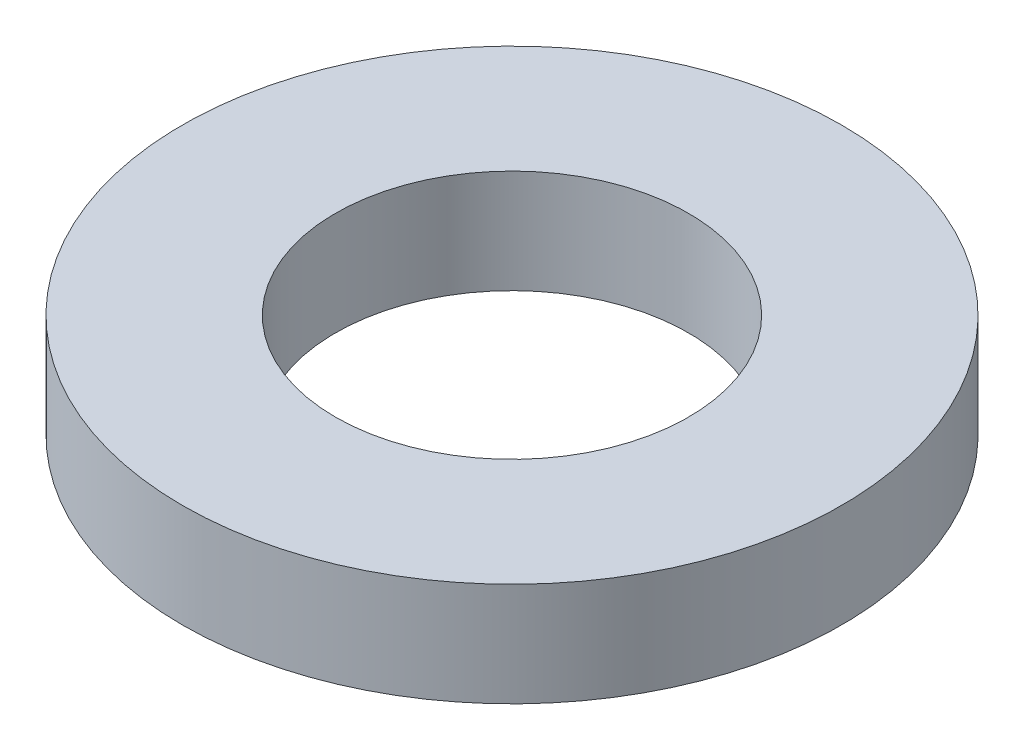
from build123d import *

# Parameters (mm, degrees)
SKETCH1_R           = 70
BOSS_EXTRUDE1_DEPTH = 22
SKETCH2_R           = 37.5
CUT_EXTRUDE1_DEPTH  = 102.410058673


with BuildPart() as part:
    # Sketch1 → Boss-Extrude1 (new body)
    with BuildSketch(Plane(origin=(0, 0, 0), x_dir=(1, 0, 0), z_dir=(0, 1, 0))):
        Circle(SKETCH1_R)
    extrude(amount=BOSS_EXTRUDE1_DEPTH)

    # Sketch2 → Cut-Extrude1 (cut, through all)
    with BuildSketch(Plane(origin=(0, 0, 0), x_dir=(1, 0, 0), z_dir=(0, 1, 0))):
        Circle(SKETCH2_R)
    extrude(amount=CUT_EXTRUDE1_DEPTH, mode=Mode.SUBTRACT)


solid = part.part
